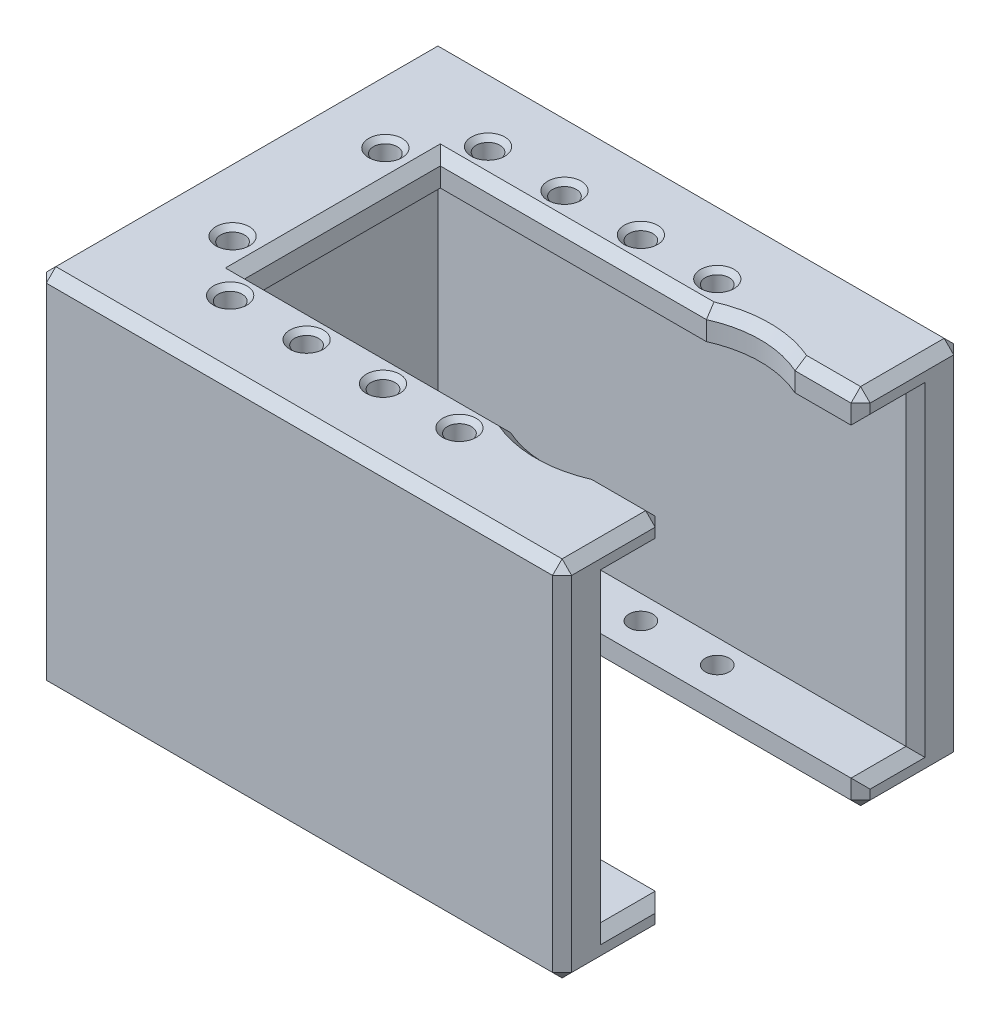
from build123d import *

# Parameters (mm, degrees)
SKETCH1_W           = 50
SKETCH1_H           = 38
BOSS_EXTRUDE1_DEPTH = 5
BOSS_EXTRUDE2_DEPTH = 3
SKETCH3_W           = 36.998366319
SKETCH3_H           = 38
BOSS_EXTRUDE3_DEPTH = 5
SKETCH4_W           = 55
SKETCH4_H           = 38
BOSS_EXTRUDE4_DEPTH = 5
BOSS_EXTRUDE7_DEPTH = 3
SKETCH8_R           = 1.25
CUT_EXTRUDE1_DEPTH  = 65.092610912
CHAMFER3_SIZE       = 0.5
CHAMFER4_SIZE       = 1


with BuildPart() as part:
    # Sketch1 → Boss-Extrude1 (new body)
    with BuildSketch(Plane.XY):
        Rectangle(SKETCH1_W, SKETCH1_H)
    extrude(amount=BOSS_EXTRUDE1_DEPTH)

    # Sketch2 → Boss-Extrude2 (add)
    with BuildSketch(Plane(origin=(0, 19, 0), x_dir=(1, 0, 0), z_dir=(0, 1, 0))):
        with BuildLine():
            Line((-25, -5), (25, -5))
            Line((25, -5), (25, -10.75))
            Line((25, -10.75), (18.136809248, -10.75))
            ThreePointArc((18.136809248, -10.75), (13.5, -9.75), (8.863190752, -10.75))
            Line((8.863190752, -10.75), (-19, -10.75))
            Line((-19, -10.75), (-19, -31.25))
            Line((-19, -31.25), (8.863190752, -31.25))
            ThreePointArc((8.863190752, -31.25), (13.5, -32.25), (18.136809248, -31.25))
            Line((18.136809248, -31.25), (25, -31.25))
            Line((25, -31.25), (25, -36.998366319))
            Line((25, -36.998366319), (-25, -36.998366319))
            Line((-25, -36.998366319), (-25, -5))
        make_face()
    extrude(amount=-BOSS_EXTRUDE2_DEPTH)

    # Sketch3 → Boss-Extrude3 (add)
    with BuildSketch(Plane.ZY.offset(25)):
        with Locations((18.49918316, 0)):
            Rectangle(SKETCH3_W, SKETCH3_H)
    extrude(amount=BOSS_EXTRUDE3_DEPTH)

    # Sketch4 → Boss-Extrude4 (add)
    with BuildSketch(Plane.XY.offset(36.998366319)):
        with Locations((-2.5, 0)):
            Rectangle(SKETCH4_W, SKETCH4_H)
    extrude(amount=BOSS_EXTRUDE4_DEPTH)

    # Sketch7 → Boss-Extrude7 (add)
    with BuildSketch(Plane.XZ.offset(19)):
        Polygon((25, 10.75), (25, 5), (-25, 5), (-25, 36.998366319), (25, 36.998366319), (25, 31.25), (-19, 31.25), (-19, 10.75), align=None)
    extrude(amount=-BOSS_EXTRUDE7_DEPTH)

    # Sketch8 → Cut-Extrude1 (cut, through all)
    with BuildSketch(Plane(origin=(0, 19, 0), x_dir=(1, 0, 0), z_dir=(0, 1, 0))):
        with Locations((-22.5, -13)):
            Circle(SKETCH8_R)
        with Locations((-17.25, -7.5)):
            Circle(SKETCH8_R)
        with Locations((-9.25, -7.5)):
            Circle(SKETCH8_R)
        with Locations((-1.25, -7.5)):
            Circle(SKETCH8_R)
        with Locations((6.75, -7.5)):
            Circle(SKETCH8_R)
        with Locations((6.75, -34.498366319)):
            Circle(SKETCH8_R)
        with Locations((-1.25, -34.498366319)):
            Circle(SKETCH8_R)
        with Locations((-9.25, -34.498366319)):
            Circle(SKETCH8_R)
        with Locations((-17.25, -34.498366319)):
            Circle(SKETCH8_R)
        with Locations((-22.5, -28.998366319)):
            Circle(SKETCH8_R)
    extrude(amount=-CUT_EXTRUDE1_DEPTH, mode=Mode.SUBTRACT)

    # Chamfer3
    chamfer3_edges = [part.edges().sort_by_distance(p)[0] for p in [
        (5.5, -19, 34.498366319),
        (-2.5, -19, 34.498366319),
        (-10.5, -19, 34.498366319),
        (-18.5, -19, 34.498366319),
        (-23.75, -19, 28.998366319),
        (-23.75, -19, 13),
        (-18.5, -19, 7.5),
        (-10.5, -19, 7.5),
        (-2.5, -19, 7.5),
        (5.5, -19, 7.5),
        (5.5, 19, 7.5),
        (-2.5, 19, 7.5),
        (-10.5, 19, 7.5),
        (-18.5, 19, 7.5),
        (-23.75, 19, 13),
        (-23.75, 19, 28.998366319),
        (-18.5, 19, 34.498366319),
        (-10.5, 19, 34.498366319),
        (-2.5, 19, 34.498366319),
        (5.5, 19, 34.498366319),
    ]]
    chamfer(chamfer3_edges, length=CHAMFER3_SIZE)

    # Chamfer4
    chamfer4_edges = [part.edges().sort_by_distance(p)[0] for p in [
        (25, 17.5, 31.25),
        (25, 16, 34.12418316),
        (25, 0, 36.998366319),
        (25, -16, 34.12418316),
        (25, -17.5, 31.25),
        (25, -19, 36.62418316),
        (25, 19, 36.62418316),
        (25, -19, 5.375),
        (-2.5, 19, 0),
        (-30, 19, 20.99918316),
        (-2.5, 19, 41.998366319),
        (25, 0, 41.998366319),
        (-2.5, -19, 41.998366319),
        (-30, 0, 41.998366319),
        (-30, -19, 20.99918316),
        (-30, 0, 0),
        (-2.5, -19, 0),
        (25, 0, 0),
        (25, 19, 5.375),
        (21.568404624, 19, 31.25),
        (13.5, 19, 32.25),
        (-5.068404624, 19, 31.25),
        (-19, 19, 21),
        (-5.068404624, 19, 10.75),
        (13.5, 19, 9.75),
        (21.568404624, 19, 10.75),
        (25, 17.5, 10.75),
        (25, 16, 7.875),
        (25, 0, 5),
        (25, -16, 7.875),
        (25, -17.5, 10.75),
        (3, -19, 10.75),
        (-19, -19, 21),
        (3, -19, 31.25),
    ]]
    chamfer(chamfer4_edges, length=CHAMFER4_SIZE)


solid = part.part
